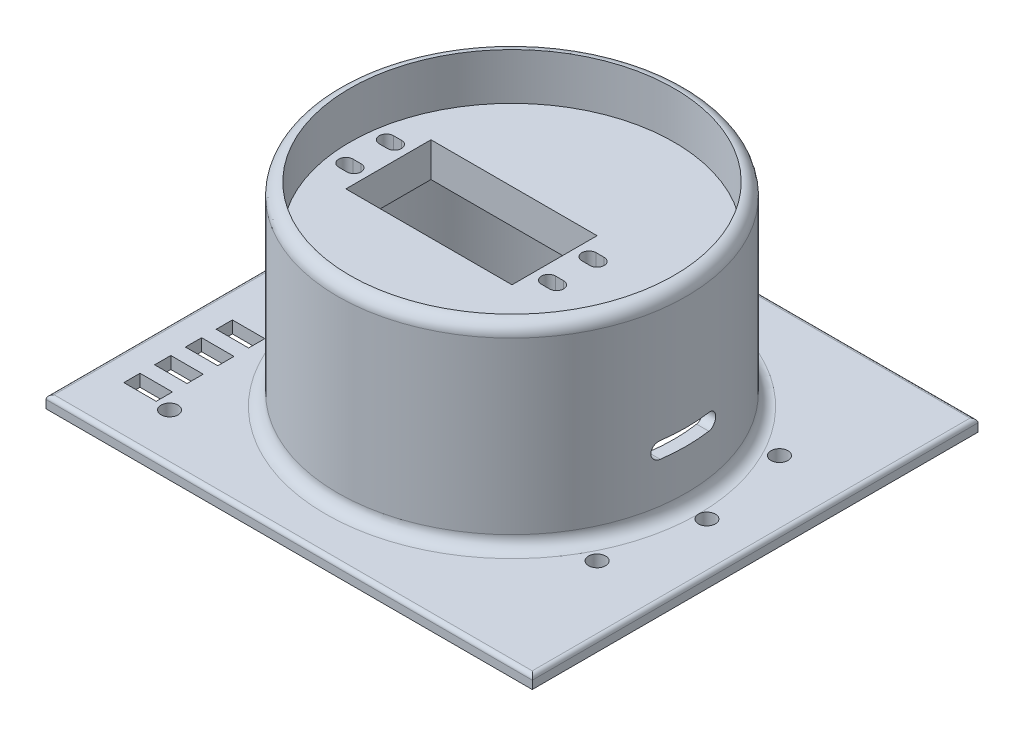
from build123d import *
from OCP.BRepFilletAPI import BRepFilletAPI_MakeFillet
from build123d.topology import SkipClean

# Parameters (mm, degrees)
SKETCH2_R               = 43
SKETCH2_R_2             = 40
BOSS_EXTRUDE1_DEPTH     = 48
SKETCH3_R               = 40
BOSS_EXTRUDE2_DEPTH     = 8.5
CUT_EXTRUDE1_DEPTH      = 71.924255371
CUT_EXTRUDE1_DEPTH_BACK = 71.924255371
SKETCH4_W               = 41
SKETCH4_H               = 21
CUT_EXTRUDE2_DEPTH      = 5
BOSS_EXTRUDE3_START     = 3
SKETCH6_W               = 120
SKETCH6_H               = 110
SKETCH6_R               = 40
BOSS_EXTRUDE3_DEPTH     = 3
FILLET1_R               = 3
FILLET1_R_2             = 1
SKETCH7_R               = 2.1
SKETCH7_W               = 8
SKETCH7_H               = 4
CUT_EXTRUDE3_DEPTH      = 3


with BuildPart() as part:
    # Sketch2 → Boss-Extrude1 (new body)
    with BuildSketch(Plane(origin=(0, 0, 0), x_dir=(1, 0, 0), z_dir=(0, 1, 0))):
        with Locations(Location((0, 0, 0), (0, 0, 270))):
            Circle(SKETCH2_R)
        with Locations(Location((0, 0, 0), (0, 0, 270))):
            Circle(SKETCH2_R_2, mode=Mode.SUBTRACT)
    extrude(amount=BOSS_EXTRUDE1_DEPTH)

    # Sketch3 → Boss-Extrude2 (add)
    with BuildSketch(Plane(origin=(0, 28, 0), x_dir=(1, 0, 0), z_dir=(0, 1, 0))):
        with Locations(Location((0, 0, 0), (0, 0, 270))):
            Circle(SKETCH3_R)
    extrude(amount=BOSS_EXTRUDE2_DEPTH)

    # Sketch4 → Cut-Extrude1 (cut, two sides: drawn at the far end of the back side and taken through both)
    with BuildSketch(Plane(origin=(0, 36.5, 0), x_dir=(1, 0, 0), z_dir=(0, 1, 0)).offset(-CUT_EXTRUDE1_DEPTH_BACK)):
        with BuildLine():
            Line((14, 6.75), (16, 6.75))
            ThreePointArc((16, 6.75), (17.75, 5), (16, 3.25))
            Line((16, 3.25), (14, 3.25))
            ThreePointArc((14, 3.25), (12.25, 5), (14, 6.75))
        make_face()
        with Locations((-10, 0)):
            Rectangle(SKETCH4_W, SKETCH4_H)
        with BuildLine():
            Line((-36, 6.75), (-34, 6.75))
            ThreePointArc((-34, 6.75), (-32.25, 5), (-34, 3.25))
            Line((-34, 3.25), (-36, 3.25))
            ThreePointArc((-36, 3.25), (-37.75, 5), (-36, 6.75))
        make_face()
        with BuildLine():
            Line((-36, -3.25), (-34, -3.25))
            ThreePointArc((-34, -3.25), (-32.25, -5), (-34, -6.75))
            Line((-34, -6.75), (-36, -6.75))
            ThreePointArc((-36, -6.75), (-37.75, -5), (-36, -3.25))
        make_face()
        with BuildLine():
            Line((14, -6.75), (16, -6.75))
            ThreePointArc((16, -6.75), (17.75, -5), (16, -3.25))
            Line((16, -3.25), (14, -3.25))
            ThreePointArc((14, -3.25), (12.25, -5), (14, -6.75))
        make_face()
    extrude(amount=CUT_EXTRUDE1_DEPTH + CUT_EXTRUDE1_DEPTH_BACK, mode=Mode.SUBTRACT)

    # Sketch5 → Cut-Extrude2 (cut)
    with BuildSketch(Plane(origin=(43, 0, 0), x_dir=(0, 0, -1), z_dir=(1, 0, 0))):
        with BuildLine():
            Line((-6, 17), (6, 17))
            ThreePointArc((6, 17), (8, 15), (6, 13))
            Line((6, 13), (-6, 13))
            ThreePointArc((-6, 13), (-8, 15), (-6, 17))
        make_face()
    extrude(amount=-CUT_EXTRUDE2_DEPTH, mode=Mode.SUBTRACT)

    # Sketch6 → Boss-Extrude3 (add)
    with SkipClean():  # the faces are left unmerged after this step: merging them gives an invalid solid
        with BuildSketch(Plane.XZ.offset(BOSS_EXTRUDE3_START)):
            Rectangle(SKETCH6_W, SKETCH6_H)
            with Locations(Location((0, 0, 0), (0, 0, 270))):
                Circle(SKETCH6_R, mode=Mode.SUBTRACT)
        extrude(amount=-BOSS_EXTRUDE3_DEPTH)

    # Fillet1
    fillet1_edges_1 = [part.edges().sort_by_distance(p)[0] for p in [
        (0, 48, -43),
        (0, 0, -43),
    ]]
    fillet1_edges_2 = [part.edges().sort_by_distance(p)[0] for p in [
        (0, 0, 55),
        (60, 0, 0),
        (-60, 0, 0),
        (0, 0, -55),
    ]]
    fillet1 = BRepFilletAPI_MakeFillet(part.part.solid().wrapped)
    for e in fillet1_edges_1:
        fillet1.Add(FILLET1_R - 0.0001, e.wrapped)
    for e in fillet1_edges_2:
        fillet1.Add(FILLET1_R_2 - 0.0001, e.wrapped)
    add(Compound.cast(fillet1.Shape()), mode=Mode.REPLACE)  # a hair under: the kernel refuses the full size

    # Sketch7 → Cut-Extrude3 (cut)
    with BuildSketch(Plane(origin=(0, 0, 0), x_dir=(1, 0, 0), z_dir=(0, 1, 0))):
        with Locations(Location((-41.5, 43, 0), (0, 0, 270))):
            Circle(SKETCH7_R)
        with Locations(Location((43.5, 22.5, 0), (0, 0, 270))):
            Circle(SKETCH7_R)
        with Locations(Location((43.5, -22.5, 0), (0, 0, 270))):
            Circle(SKETCH7_R)
        with Locations(Location((-41.5, -43, 0), (0, 0, 270))):
            Circle(SKETCH7_R)
        with Locations(Location((48.1, 0, 0), (0, 0, 270))):
            Circle(SKETCH7_R)
        with Locations((-49, 25.6)):
            Rectangle(SKETCH7_W, SKETCH7_H)
        with Locations((-49, 18)):
            Rectangle(SKETCH7_W, SKETCH7_H)
        with Locations((-49, 33.2)):
            Rectangle(SKETCH7_W, SKETCH7_H)
        with Locations((-49, 40.8)):
            Rectangle(SKETCH7_W, SKETCH7_H)
        with Locations((-49, -40.8)):
            Rectangle(SKETCH7_W, SKETCH7_H)
        with Locations((-49, -33.2)):
            Rectangle(SKETCH7_W, SKETCH7_H)
        with Locations((-49, -25.6)):
            Rectangle(SKETCH7_W, SKETCH7_H)
        with Locations((-49, -18)):
            Rectangle(SKETCH7_W, SKETCH7_H)
    extrude(amount=-CUT_EXTRUDE3_DEPTH, mode=Mode.SUBTRACT)


solid = part.part
